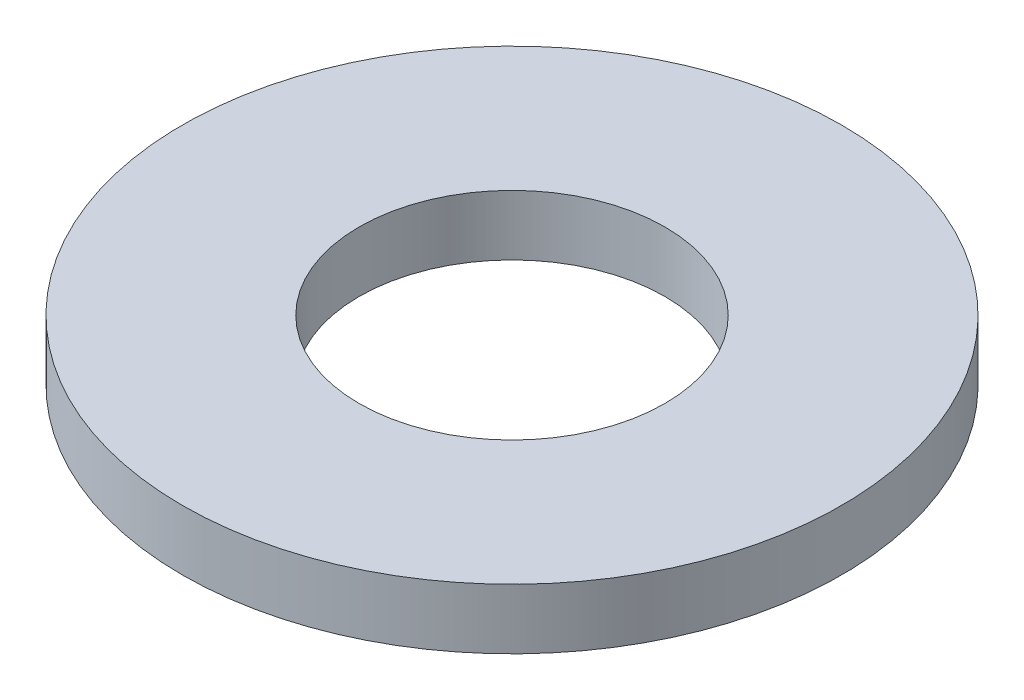
from build123d import *

# Parameters (mm, degrees)
SKETCH1_R           = 5.55625
BOSS_EXTRUDE1_DEPTH = 1.016
SKETCH5_R           = 2.5781
CUT_EXTRUDE1_DEPTH  = 8.923136003


with BuildPart() as part:
    # Sketch1 → Boss-Extrude1 (new body)
    with BuildSketch(Plane(origin=(0, 0, 0), x_dir=(1, 0, 0), z_dir=(0, 1, 0))):
        Circle(SKETCH1_R)
    extrude(amount=BOSS_EXTRUDE1_DEPTH)

    # Sketch5 → Cut-Extrude1 (cut, through all)
    with BuildSketch(Plane(origin=(0, 1.016, 0), x_dir=(-1, 0, 0), z_dir=(0, 1, 0))):
        Circle(SKETCH5_R)
    extrude(amount=-CUT_EXTRUDE1_DEPTH, mode=Mode.SUBTRACT)


solid = part.part
